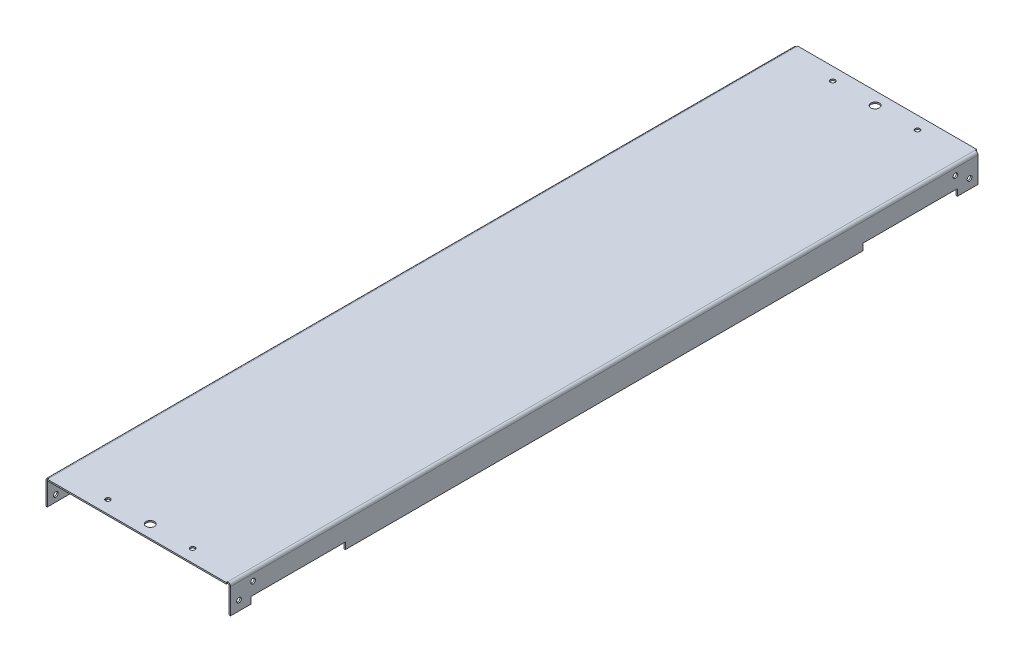
from build123d import *

# Parameters (mm, degrees)
SM_BASE_FLANGE_1_DEPTH = 398.5
SKETCH_6_W             = 1.5
SKETCH_6_H             = 30
CUT_EXTRUDE_1_DEPTH    = 3
SKETCH_7_W             = 23.5
SKETCH_7_H             = 35.5
CUT_EXTRUDE_2_DEPTH    = 3
SKETCH_8_R             = 2.5
CUT_EXTRUDE_3_DEPTH    = 446.104762949
SKETCH_10_R            = 2.5
SKETCH_10_R_2          = 4.5
CUT_EXTRUDE_4_DEPTH    = 10
SKETCH_11_W            = 100
SKETCH_11_H            = 7
CUT_EXTRUDE_2108_DEPTH = 10


# Sheet-metal steps are written as plain solids
with BuildPart() as part:
    # Sketch 1 → Базовая кромка1 (new, symmetric)
    with BuildSketch(Plane.XY):
        with BuildLine():
            Line((-74.5, -30), (-95, -30))
            ThreePointArc((-95, -30), (-97.121320344, -29.121320344), (-98, -27))
            Line((-98, -27), (-98, -3))
            ThreePointArc((-98, -3), (-97.121320344, -0.878679656), (-95, 0))
            Line((-95, 0), (95, 0))
            ThreePointArc((95, 0), (97.121320344, -0.878679656), (98, -3))
            Line((98, -3), (98, -30))
            Line((98, -30), (96.5, -30))
            Line((96.5, -30), (96.5, -3))
            ThreePointArc((96.5, -3), (96.060660172, -1.939339828), (95, -1.5))
            Line((95, -1.5), (-95, -1.5))
            ThreePointArc((-95, -1.5), (-96.060660172, -1.939339828), (-96.5, -3))
            Line((-96.5, -3), (-96.5, -27))
            ThreePointArc((-96.5, -27), (-96.060660172, -28.060660172), (-95, -28.5))
            Line((-95, -28.5), (-74.5, -28.5))
            Line((-74.5, -28.5), (-74.5, -30))
        make_face()
    extrude(amount=SM_BASE_FLANGE_1_DEPTH, both=True)

    # Эскиз6 → Вырез-Вытянуть1 (cut)
    with BuildSketch(Plane.ZY.offset(98)):
        with Locations((397.75, -15)):
            Rectangle(SKETCH_6_W, SKETCH_6_H)
        with Locations((-397.75, -15)):
            Rectangle(SKETCH_6_W, SKETCH_6_H)
    cut_extrude_1 = extrude(amount=-CUT_EXTRUDE_1_DEPTH, mode=Mode.SUBTRACT)

    # Зеркальное отражение1: Вырез-Вытянуть1 across plane
    add(cut_extrude_1.mirror(Plane(origin=(0, 0, 0), x_dir=(0, 0, 1), z_dir=(1, 0, 0))), mode=Mode.SUBTRACT)

    # Эскиз7 → Вырез-Вытянуть2 (cut)
    with BuildSketch(Plane.XZ.offset(30)):
        with Locations((-86.25, 380.75)):
            Rectangle(SKETCH_7_W, SKETCH_7_H)
        with Locations((-86.25, -380.75)):
            Rectangle(SKETCH_7_W, SKETCH_7_H)
    extrude(amount=-CUT_EXTRUDE_2_DEPTH, mode=Mode.SUBTRACT)

    # Эскиз8 → Вырез-Вытянуть3 (cut, through all)
    with BuildSketch(Plane.ZY.offset(98)):
        with Locations((-388, -20)):
            Circle(SKETCH_8_R)
        with Locations((-373, -10)):
            Circle(SKETCH_8_R)
        with Locations(Location((373, -10, 0), (0, 0, 180))):
            Circle(SKETCH_8_R)
        with Locations(Location((388, -20, 0), (0, 0, 180))):
            Circle(SKETCH_8_R)
    extrude(amount=-CUT_EXTRUDE_3_DEPTH, mode=Mode.SUBTRACT)

    # Эскиз10 → Вырез-Вытянуть4 (cut)
    with BuildSketch(Plane(origin=(0, 0, 0), x_dir=(1, 0, 0), z_dir=(0, 1, 0))):
        with Locations(Location((-44.25, -385, 0), (0, 0, 270))):
            Circle(SKETCH_10_R)
        with Locations(Location((0.75, -385, 0), (0, 0, 270))):
            Circle(SKETCH_10_R_2)
        with Locations(Location((45.75, -385, 0), (0, 0, 270))):
            Circle(SKETCH_10_R)
        with Locations(Location((45.75, 385, 0), (0, 0, 90))):
            Circle(SKETCH_10_R)
        with Locations(Location((0.75, 385, 0), (0, 0, 90))):
            Circle(SKETCH_10_R_2)
        with Locations(Location((-44.25, 385, 0), (0, 0, 90))):
            Circle(SKETCH_10_R)
    extrude(amount=-CUT_EXTRUDE_4_DEPTH, mode=Mode.SUBTRACT)

    # Эскиз11 → Cut-Extrude 2108 (cut)
    with BuildSketch(Plane(origin=(98, 0, 0), x_dir=(0, 0, -1), z_dir=(1, 0, 0))):
        with Locations((325, -26.5)):
            Rectangle(SKETCH_11_W, SKETCH_11_H)
        with Locations((-325, -26.5)):
            Rectangle(SKETCH_11_W, SKETCH_11_H)
    extrude(amount=-CUT_EXTRUDE_2108_DEPTH, mode=Mode.SUBTRACT)


solid = part.part
